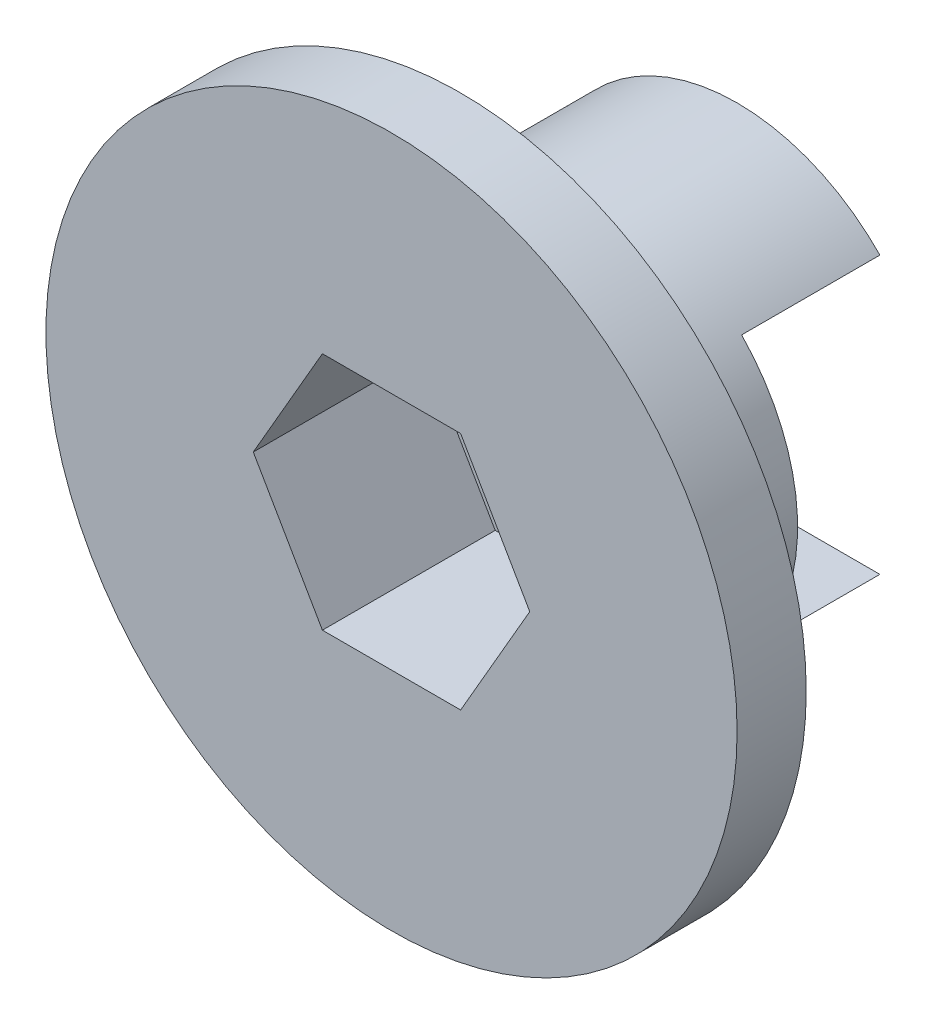
from build123d import *

# Parameters (mm, degrees)
SKETCH1_R               = 11.5
SKETCH1_R_2             = 5
BOSS_EXTRUDE1_DEPTH     = 20
CUT_EXTRUDE1_DEPTH      = 10
CUT_EXTRUDE2_DEPTH      = 26.777897509
CUT_EXTRUDE2_DEPTH_BACK = 26.777897509
SKETCH3_W               = 8
SKETCH3_H               = 16
BOSS_EXTRUDE2_START     = -4
SKETCH4_R               = 20
SKETCH4_R_2             = 11.5
BOSS_EXTRUDE2_DEPTH     = 4


with BuildPart() as part:
    # Sketch1 → Boss-Extrude1 (new body)
    with BuildSketch(Plane.XY):
        Circle(SKETCH1_R)
        Circle(SKETCH1_R_2, mode=Mode.SUBTRACT)
    extrude(amount=BOSS_EXTRUDE1_DEPTH)

    # Sketch2 → Cut-Extrude1 (cut)
    with BuildSketch(Plane.XY.offset(20)):
        Polygon((8, 0), (4, 6.92820323), (-4, 6.92820323), (-8, 0), (-4, -6.92820323), (4, -6.92820323), align=None)
    extrude(amount=-CUT_EXTRUDE1_DEPTH, mode=Mode.SUBTRACT)

    # Sketch3 → Cut-Extrude2 (cut, two sides: drawn at the far end of the back side and taken through both)
    with BuildSketch(Plane(origin=(0, 0, 0), x_dir=(0, 0, -1), z_dir=(1, 0, 0)).offset(-CUT_EXTRUDE2_DEPTH_BACK)):
        with Locations((-4, 0)):
            Rectangle(SKETCH3_W, SKETCH3_H)
    extrude(amount=CUT_EXTRUDE2_DEPTH + CUT_EXTRUDE2_DEPTH_BACK, mode=Mode.SUBTRACT)

    # Sketch4 → Boss-Extrude2 (add)
    with BuildSketch(Plane.XY.offset(20).offset(BOSS_EXTRUDE2_START)):
        Circle(SKETCH4_R)
        Circle(SKETCH4_R_2, mode=Mode.SUBTRACT)
    extrude(amount=BOSS_EXTRUDE2_DEPTH)


solid = part.part
